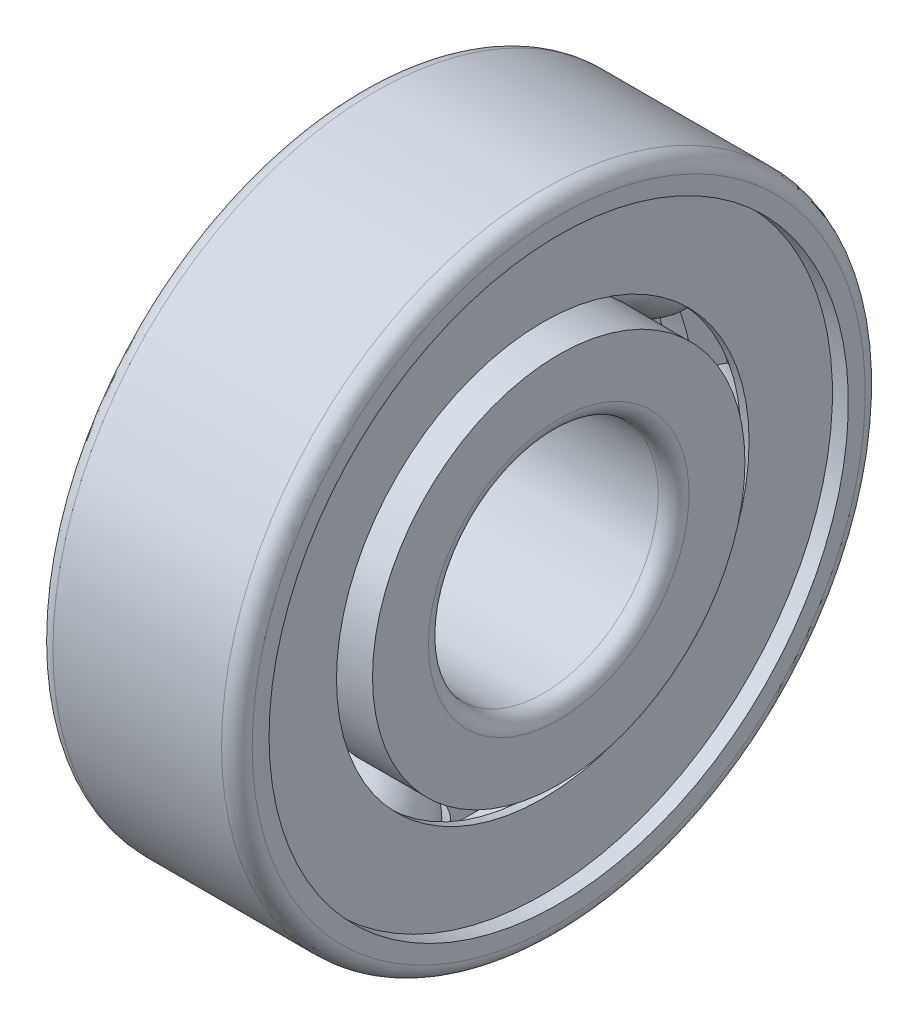
from build123d import *

# Parameters (mm, degrees)
SKETCH_2_W               = 1.74636
SKETCH_2_H               = 2.18295
PATTERN_CIRCULAR_1_COUNT = 7
SKETCH_4_W               = 8.7318
SKETCH_4_H               = 4.3659
SKETCH_5_W               = 8.7318
SKETCH_5_H               = 4.3659
PATTERN_CIRCULAR_2_COUNT = 7
SKETCH_10_W              = 0.535202389
SKETCH_10_H              = 4.84023
SKETCH_11_R              = 21
CUT_EXTRUDE_1_DEPTH      = 10


with BuildPart() as part:
    # 草图2 → Revolve 594 (revolve)
    with BuildSketch(Plane.XY):
        with Locations((0, 15.525)):
            Rectangle(SKETCH_2_W, SKETCH_2_H)
    revolve(axis=Axis((-12.420610377, 0, 0), (1, 0, 0)))

    # 草图3 → 凸台-旋转1 (revolve)
    with BuildSketch(Plane.XY):
        with BuildLine():
            Line((-4.3659, 15.525), (4.3659, 15.525))
            ThreePointArc((4.3659, 15.525), (0, 11.1591), (-4.3659, 15.525))
        make_face()
    revolve_1 = revolve(axis=Axis((-5.568093779, 15.525, 0), (1, 0, 0)))

    # 阵列(圆周)1: 凸台-旋转1 ×7 about axis
    pattern_circular_1_axis = Axis((-12.420610377, 0, 0), (1, 0, 0))
    for i in range(1, PATTERN_CIRCULAR_1_COUNT):
        add(revolve_1.rotate(pattern_circular_1_axis, i * 360 / PATTERN_CIRCULAR_1_COUNT))

    # 草图4 → 切除-旋转1 (revolve, cut)
    with BuildSketch(Plane.XY):
        with Locations((0, 18.799425)):
            Rectangle(SKETCH_4_W, SKETCH_4_H)
    revolve(axis=Axis((0, 0, 0), (1, 0, 0)), mode=Mode.SUBTRACT)

    # 草图5 → 切除-旋转2 (revolve, cut)
    with BuildSketch(Plane.XY):
        with Locations((0, 12.250575)):
            Rectangle(SKETCH_5_W, SKETCH_5_H)
    revolve(axis=Axis((0, 0, 0), (1, 0, 0)), mode=Mode.SUBTRACT)

    # 草图6 → 凸台-旋转2 (revolve)
    with BuildSketch(Plane.XY):
        with BuildLine():
            Line((-3.969, 15.525), (3.969, 15.525))
            ThreePointArc((3.969, 15.525), (0, 11.556), (-3.969, 15.525))
        make_face()
    revolve_2 = revolve(axis=Axis((-5.568093779, 15.525, 0), (1, 0, 0)))

    # 阵列(圆周)2: 凸台-旋转2 ×7 about axis
    pattern_circular_2_axis = Axis((-12.420610377, 0, 0), (1, 0, 0))
    for i in range(1, PATTERN_CIRCULAR_2_COUNT):
        add(revolve_2.rotate(pattern_circular_2_axis, i * 360 / PATTERN_CIRCULAR_2_COUNT))

    # 草图7 → 凸台-旋转3 (revolve)
    with BuildSketch(Plane.XY):
        with BuildLine():
            Line((-5.5, 21), (5.5, 21))
            ThreePointArc((5.5, 21), (6.207106781, 20.707106781), (6.5, 20))
            Line((6.5, 20), (6.5, 18.9))
            Line((6.5, 18.9), (5.46, 18.9))
            Line((5.46, 18.9), (5.46, 18.3))
            Line((5.46, 18.3), (4.924797611, 18.3))
            Line((4.924797611, 18.3), (4.924797611, 18.9))
            Line((4.924797611, 18.9), (2.069554541, 18.9))
            ThreePointArc((2.069554541, 18.9), (0, 19.484), (-2.069554541, 18.9))
            Line((-2.069554541, 18.9), (-6.5, 18.9))
            Line((-6.5, 18.9), (-6.5, 20))
            ThreePointArc((-6.5, 20), (-6.207106781, 20.707106781), (-5.5, 21))
        make_face()
    revolve(axis=Axis((0, 0, 0), (1, 0, 0)))

    # 草图8 → 凸台-旋转4 (revolve)
    with BuildSketch(Plane.XY):
        with BuildLine():
            Line((-6.5, 12.15), (-2.069554541, 12.15))
            ThreePointArc((-2.069554541, 12.15), (0, 11.566), (2.069554541, 12.15))
            Line((2.069554541, 12.15), (6.5, 12.15))
            Line((6.5, 12.15), (6.5, 8.5))
            ThreePointArc((6.5, 8.5), (6.207106781, 7.792893219), (5.5, 7.5))
            Line((5.5, 7.5), (-5.5, 7.5))
            ThreePointArc((-5.5, 7.5), (-6.207106781, 7.792893219), (-6.5, 8.5))
            Line((-6.5, 8.5), (-6.5, 12.15))
        make_face()
    revolve(axis=Axis((-12.420610377, 0, 0), (1, 0, 0)))

    # 草图10 → 凸台-旋转5 (revolve)
    with BuildSketch(Plane.XY):
        with Locations((5.192398805, 15.879885)):
            Rectangle(SKETCH_10_W, SKETCH_10_H)
    revolve(axis=Axis((0, 0, 0), (-1, 0, 0)))

    # 草图11 → 切除-拉伸1 (cut)
    with BuildSketch(Plane(origin=(0, 0, 0), x_dir=(0, 0, -1), z_dir=(1, 0, 0))):
        Circle(SKETCH_11_R)
    extrude(amount=-CUT_EXTRUDE_1_DEPTH, mode=Mode.SUBTRACT)

    # 镜向所有1: part across plane


with BuildPart() as part_1:
    add(part.part)
    add(part.part.mirror(Plane(origin=(0, 0, 0), x_dir=(0, 0, 1), z_dir=(1, 0, 0))))


solid = part_1.part
